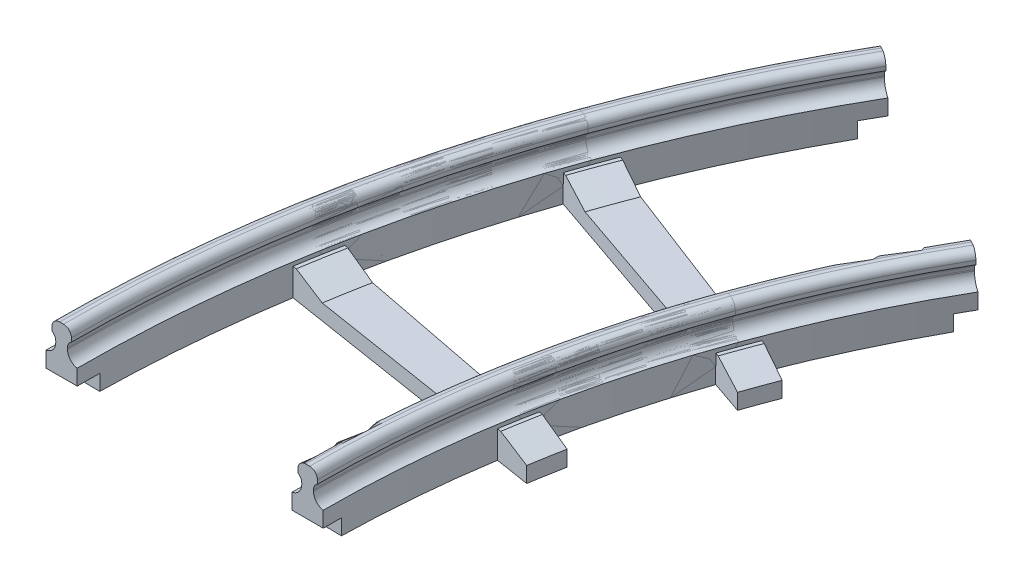
from build123d import *

# Parameters (mm, degrees)
REVOLVE_1_ANGLE          = 10
FILLET_1_R               = 1.5
FILLET_2_R               = 1.5
FILLET_3_R               = 1
FILLET_4_R               = 1
SKETCH_7_W               = 4
SKETCH_7_H               = 2
CUT_REVOLVE_1_ANGLE      = 1
SKETCH_10_R              = 0.4
CUT_EXTRUDE_1_DEPTH      = 2
REVOLVE_2_ANGLE          = 1
PATTERN_CIRCULAR_1_COUNT = 2
PATTERN_CIRCULAR_1_ANGLE = 10


with BuildPart() as part:
    # 草图4 → 旋转1 (revolve)
    with BuildSketch(Plane.XY):
        Polygon((0.75, -1.5), (1.25, -1.5), (1.25, 0), (0, 0), (-1.25, 0), (-1.25, -1.5), (-0.75, -1.5), (-0.75, -4), (-2, -4), (-2, -8), (0, -8), (2, -8), (2, -4), (0.75, -4), align=None)
        Polygon((31.5, 0), (32.75, 0), (32.75, -1.5), (32.25, -1.5), (32.25, -4), (33.5, -4), (33.5, -8), (31.5, -8), (29.5, -8), (29.5, -4), (30.75, -4), (30.75, -1.5), (30.25, -1.5), (30.25, 0), align=None)
    revolve(axis=Axis((165.75, 3.853460973, 0), (0, -1, 0)), revolution_arc=REVOLVE_1_ANGLE)

    # 圆角1
    # the kernel refuses this fillet: 1.5 mm, written as the material it adds along each edge
    with BuildSketch(Plane(origin=(165.75, -4, 0), x_dir=(-1, 0, 0), z_dir=(0, 0, 1))) as fillet_1_piece_1:
        with BuildLine():
            CenterArc((163.5, -1.479019946), FILLET_1_R, 0, 80.405931773)
            Line((165, -1.479019946), (165.03, -1.479019946))
            Line((165.03, -1.479019946), (165.03, 0))
            Line((165.03, 0), (165, 0.03))
            ThreePointArc((165, 0.03), (164.375, 0.03), (163.755, 0.029580399))
            Line((163.755, 0.029580399), (163.75, 0))
        make_face()
    revolve(axis=Axis((165.75, -4, 0), (0, -1, 0)), revolution_arc=10)
    with BuildSketch(Plane(origin=(165.75, -4, 0), x_dir=(-1, 0, 0), z_dir=(0, 0, 1))) as fillet_1_piece_2:
        with BuildLine():
            CenterArc((168, -1.479019946), FILLET_1_R, 99.594068227, 80.405931773)
            Line((166.5, -1.479019946), (166.47, -1.479019946))
            Line((166.47, -1.479019946), (166.47, 0))
            Line((166.47, 0), (166.5, 0.03))
            ThreePointArc((166.5, 0.03), (167.125, 0.03), (167.745, 0.029580399))
            Line((167.745, 0.029580399), (167.75, 0))
        make_face()
    revolve(axis=Axis((165.75, -4, 0), (0, -1, 0)), revolution_arc=10)

    # 圆角2
    # the kernel refuses this fillet: 1.5 mm, written as the material it adds along each edge
    with BuildSketch(Plane(origin=(165.75, -4, 0), x_dir=(-1, 0, 0), z_dir=(0, 0, 1))) as fillet_2_piece_1:
        with BuildLine():
            CenterArc((136.5, -1.479019946), FILLET_2_R, 99.594068227, 80.405931773)
            Line((136.25, 0), (136.245, 0.029580399))
            ThreePointArc((136.245, 0.029580399), (135.625, 0.03), (135, 0.03))
            Line((135, 0.03), (134.97, 0))
            Line((134.97, 0), (134.97, -1.479019946))
            Line((134.97, -1.479019946), (135, -1.479019946))
        make_face()
    revolve(axis=Axis((165.75, -4, 0), (0, -1, 0)), revolution_arc=10)
    with BuildSketch(Plane(origin=(165.75, -4, 0), x_dir=(-1, 0, 0), z_dir=(0, 0, 1))) as fillet_2_piece_2:
        with BuildLine():
            CenterArc((132, -1.479019946), FILLET_2_R, 0, 80.405931773)
            Line((133.5, -1.479019946), (133.53, -1.479019946))
            Line((133.53, -1.479019946), (133.53, 0))
            Line((133.53, 0), (133.5, 0.03))
            ThreePointArc((133.5, 0.03), (132.875, 0.03), (132.255, 0.029580399))
            Line((132.255, 0.029580399), (132.25, 0))
        make_face()
    revolve(axis=Axis((165.75, -4, 0), (0, -1, 0)), revolution_arc=10)

    # 圆角3
    # the kernel refuses this fillet: 1 mm, written as the material it adds along each edge
    with BuildSketch(Plane(origin=(165.75, -1.5, 0), x_dir=(-1, 0, 0), z_dir=(0, 0, 1))) as fillet_3_piece_1:
        with BuildLine():
            CenterArc((136, 0.866025404), FILLET_3_R, 180, 60)
            Line((135, 0.866025404), (135, 0))
            Line((135, 0), (135.5, 0))
        make_face()
    revolve(axis=Axis((165.75, -1.5, 0), (0, -1, 0)), revolution_arc=10)
    with BuildSketch(Plane(origin=(165.75, -1.5, 0), x_dir=(-1, 0, 0), z_dir=(0, 0, 1))) as fillet_3_piece_2:
        with BuildLine():
            CenterArc((132.5, 0.866025404), FILLET_3_R, 300, 60)
            Line((133, 0), (133.5, 0))
            Line((133.5, 0), (133.5, 0.866025404))
        make_face()
    revolve(axis=Axis((165.75, -1.5, 0), (0, -1, 0)), revolution_arc=10)
    # the kernel refuses this fillet: 1 mm, written as the material it takes off along each edge
    with BuildSketch(Plane(origin=(165.75, 0, 0), x_dir=(-0.9998233399867428, 0, 0.018795978765534377), z_dir=(0.018795978765534377, 0, 0.9998233399867428))) as fillet_3_2_piece_1:
        with BuildLine():
            CenterArc((133 + FILLET_3_R, FILLET_3_R), FILLET_3_R, 180, 90)
            Line((133, FILLET_3_R), (133, 0))
            Line((133, 0), (133 + FILLET_3_R, 0))
        make_face()
    revolve(axis=Axis((165.75, 0, 0), (0, -1, 0)), revolution_arc=12.153987353, mode=Mode.SUBTRACT)
    with BuildSketch(Plane(origin=(165.75, 0, 0), x_dir=(-0.9998297984864879, 0, 0.01844922921070363), z_dir=(0.01844922921070363, 0, 0.9998297984864879))) as fillet_3_2_piece_2:
        with BuildLine():
            CenterArc((135.5 - FILLET_3_R, FILLET_3_R), FILLET_3_R, 270, 90)
            Line((135.5 - FILLET_3_R, 0), (135.5, 0))
            Line((135.5, 0), (135.5, FILLET_3_R))
        make_face()
    revolve(axis=Axis((165.75, 0, 0), (0, -1, 0)), revolution_arc=12.114245889, mode=Mode.SUBTRACT)

    # 圆角4
    # the kernel refuses this fillet: 1 mm, written as the material it adds along each edge
    with BuildSketch(Plane(origin=(165.75, -1.5, 0), x_dir=(-1, 0, 0), z_dir=(0, 0, 1))) as fillet_4_piece_1:
        with BuildLine():
            CenterArc((167.5, 0.866025404), FILLET_4_R, 180, 60)
            Line((167, 0), (166.5, 0))
            Line((166.5, 0), (166.5, 0.866025404))
        make_face()
    revolve(axis=Axis((165.75, -1.5, 0), (0, -1, 0)), revolution_arc=10)
    with BuildSketch(Plane(origin=(165.75, -1.5, 0), x_dir=(-1, 0, 0), z_dir=(0, 0, 1))) as fillet_4_piece_2:
        with BuildLine():
            CenterArc((164, 0.866025404), FILLET_4_R, 300, 60)
            Line((164.5, 0), (165, 0))
            Line((165, 0), (165, 0.866025404))
        make_face()
    revolve(axis=Axis((165.75, -1.5, 0), (0, -1, 0)), revolution_arc=10)
    # the kernel refuses this fillet: 1 mm, written as the material it takes off along each edge
    with BuildSketch(Plane(origin=(165.75, 0, 0), x_dir=(-0.9998845180351503, 0, 0.015197058715919934), z_dir=(0.015197058715919934, 0, 0.9998845180351503))) as fillet_4_2_piece_1:
        with BuildLine():
            CenterArc((164.5 + FILLET_4_R, FILLET_4_R), FILLET_4_R, 180, 90)
            Line((164.5, FILLET_4_R), (164.5, 0))
            Line((164.5, 0), (164.5 + FILLET_4_R, 0))
        make_face()
    revolve(axis=Axis((165.75, 0, 0), (0, -1, 0)), revolution_arc=11.74152169, mode=Mode.SUBTRACT)
    with BuildSketch(Plane(origin=(165.75, 0, 0), x_dir=(-0.9998879496351009, 0, 0.014969574961036002), z_dir=(0.014969574961036002, 0, 0.9998879496351009))) as fillet_4_2_piece_2:
        with BuildLine():
            CenterArc((167 - FILLET_4_R, FILLET_4_R), FILLET_4_R, 270, 90)
            Line((167 - FILLET_4_R, 0), (167, 0))
            Line((167, 0), (167, FILLET_4_R))
        make_face()
    revolve(axis=Axis((165.75, 0, 0), (0, -1, 0)), revolution_arc=11.715451006, mode=Mode.SUBTRACT)

    # 草图7 → 切除-旋转1 (revolve, cut)
    with BuildSketch(Plane.XY):
        with Locations((0, -7)):
            Rectangle(SKETCH_7_W, SKETCH_7_H)
        with Locations((31.5, -7)):
            Rectangle(SKETCH_7_W, SKETCH_7_H)
    revolve(axis=Axis((165.75, 3.853460973, 0), (0, -1, 0)), revolution_arc=CUT_REVOLVE_1_ANGLE, mode=Mode.SUBTRACT)

    # 草图10 → 切除-拉伸1 (cut)
    with BuildSketch(Plane.XZ.offset(6)):
        with Locations(Location((0.006311252, -1.446423259, 0), (0, 0, 270))):
            Circle(SKETCH_10_R)
        with Locations(Location((31.505111829, -1.171537391, 0), (0, 0, 270))):
            Circle(SKETCH_10_R)
    extrude(amount=-CUT_EXTRUDE_1_DEPTH, mode=Mode.SUBTRACT)

    # 草图11 → 旋转2 (revolve)
    with BuildSketch(Plane(origin=(4.997974052, 0, -28.344919378), x_dir=(-0.9848077530122081, 0, -0.17364817766693072), z_dir=(0.17364817766693072, 0, -0.9848077530122081))):
        Polygon((-26.981885062, -4.5), (-26.481885062, -4.5), (-22.481885062, -6), (-3.981885062, -6), (0.018114938, -4.5), (0.518114938, -4.5), (4.518114938, -4.5), (5.018114938, -4.5), (9.018114938, -6), (9.018114938, -8), (4.518114938, -8), (0.518114938, -8), (-26.981885062, -8), (-30.981885062, -8), (-35.481885062, -8), (-35.481885062, -6), (-31.481885062, -4.5), (-30.981885062, -4.5), align=None)
    revolve(axis=Axis((165.75, 3.853460973, 0), (0, 1, 0)), revolution_arc=REVOLVE_2_ANGLE)

    # 镜向1: part across face


with BuildPart() as part_1:
    add(part.part)
    add(part.part.mirror(Plane(origin=(18.028837048, -5.996688627, -26.04722665), x_dir=(0.9848077529548817, 0, 0.17364817799204443), z_dir=(0.17364817799204443, 0, -0.9848077529548818))))


with BuildPart() as pattern_circular_1_1:
    # 阵列(圆周)1: pattern copy
    add(part_1.part.rotate(Axis((165.75, 0, 0), (0, -1, 0)), 1 * PATTERN_CIRCULAR_1_ANGLE / (PATTERN_CIRCULAR_1_COUNT - 1)))


solid = Compound([part_1.part, pattern_circular_1_1.part])
